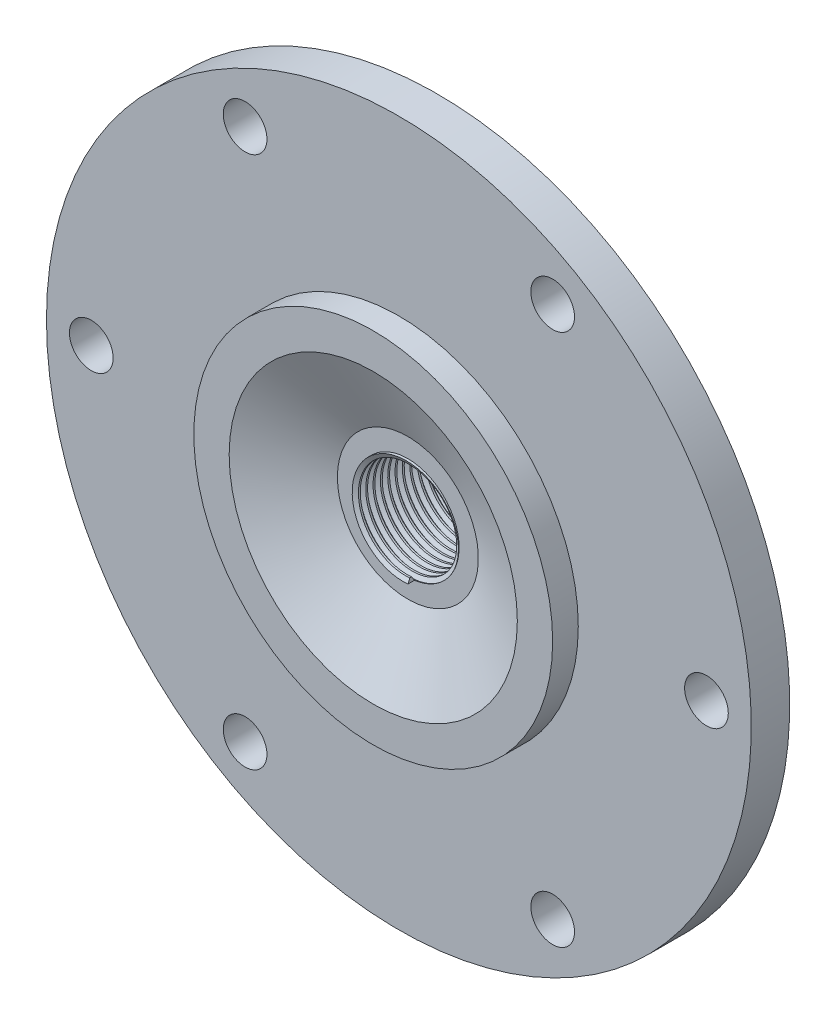
from build123d import *
from build123d.topology import SkipClean

# Parameters (mm, degrees)
SKETCH1_R                  = 43.65625
BOSS_EXTRUDE1_DEPTH        = 4.7625
SKETCH2_R                  = 22.225
BOSS_EXTRUDE2_DEPTH        = 3.175
SKETCH3_R                  = 9.525
BOSS_EXTRUDE3_DEPTH        = 14.2875
CHAMFER1_SIZE              = 6.35
CHAMFER1_SIZE2             = 3.666174209
F_3_0_213_DIAMETER_HOLE1_D = 5.4102
CUT_EXTRUDE1_REACH         = 67.618
SKETCH5_R                  = 6.35
THREAD1_PITCH              = 0.907142857


with BuildPart() as part:
    # Sketch1 → Boss-Extrude1 (new body)
    with BuildSketch(Plane.XY):
        with Locations(Location((0, 0, 0), (0, 0, 180))):
            Circle(SKETCH1_R)
    extrude(amount=BOSS_EXTRUDE1_DEPTH)

    # Sketch2 → Boss-Extrude2 (add)
    with BuildSketch(Plane.XY.offset(4.7625)):
        Circle(SKETCH2_R)
    extrude(amount=BOSS_EXTRUDE2_DEPTH)

    # Sketch3 → Boss-Extrude3 (add)
    with BuildSketch(Plane(origin=(0, 0, 0), x_dir=(-1, 0, 0), z_dir=(0, 0, -1))):
        Circle(SKETCH3_R)
    extrude(amount=BOSS_EXTRUDE3_DEPTH)

    # Chamfer1
    chamfer1_edges = [part.edges().sort_by_distance(p)[0] for p in [
        (9.525, 0, 0),
    ]]
    chamfer1_side = [part.faces().sort_by_distance(p)[0] for p in [
        (42.421464783, 0, 0),
    ]]
    chamfer(chamfer1_edges, length=CHAMFER1_SIZE, length2=CHAMFER1_SIZE2, reference=chamfer1_side[0])

    # Sketch4 → Cut-Revolve1 (revolve, cut)
    with BuildSketch(Plane(origin=(0, 0, 0), x_dir=(1, 0, 0), z_dir=(0, 1, 0)), mode=Mode.PRIVATE) as cut_revolve1_sk:
        Polygon((0, -3.647086845), (-8.73125, -3.647086845), (-17.848377953, -7.9375), (0, -7.9375), align=None)
    revolve(cut_revolve1_sk.sketch.rotate(Axis((0, 0, 3.647086845), (0, 0, 1)), 180), axis=Axis((0, 0, 3.647086845), (0, 0, 1)), mode=Mode.SUBTRACT)

    # #3 (0.213) Diameter Hole1 (through all)
    with Locations(Plane(origin=(-19.05, 32.995567884, 0), x_dir=(-1, 0, 0), z_dir=(0, 0, -1))):
        with Locations((0, 0), (-57.15, -32.995567884), (19.05, -32.995567884), (-38.1, 0), (-38.1, -65.991135768), (0, -65.991135768)):
            Hole(F_3_0_213_DIAMETER_HOLE1_D / 2)

    # Sketch5 → Cut-Extrude1 (cut, up to next)
    with BuildSketch(Plane(origin=(0, 0, -14.2875), x_dir=(-1, 0, 0), z_dir=(0, 0, -1)), mode=Mode.PRIVATE) as cut_extrude1_sk1:
        Circle(SKETCH5_R)
    cut_extrude1_tool1 = extrude(cut_extrude1_sk1.sketch, amount=-CUT_EXTRUDE1_REACH, mode=Mode.PRIVATE) & part.part
    add(cut_extrude1_tool1.solids().sort_by_distance((0, 0, -14.2875))[0], mode=Mode.SUBTRACT)

    # Thread1: the profile of Thread Profile1 profile screwed along a right-hand helix of 19.770411 turns, 8 arcs to a turn; built about Z, then put on its axis
    with SkipClean():  # the faces are left unmerged after this step: merging them gives an invalid solid
        thread1_z = Axis((0, 0, 0), (0, 0, 1))
        thread1_corners = [(6.3503, 0, -0.000173205), (6.3503, 0, 0.793923203), (5.858994528, 0, 0.510267856), (5.858994528, 0, 0.283482142)]
        with BuildLine(mode=Mode.PRIVATE) as thread1_profile:
            Line(thread1_corners[0], thread1_corners[1])
            Line(thread1_corners[1], thread1_corners[2])
            Line(thread1_corners[2], thread1_corners[3])
            Line(thread1_corners[3], thread1_corners[0])
        thread1_cap = Face(thread1_profile.wire())
        thread1_turn_angles = [0, 22.5, 45, 67.5, 90, 112.5, 135, 157.5, 180, 202.5, 225, 247.5, 270, 292.5, 315, 337.5, 360]
        thread1_turn_weights = [1, 0.9238795325112867, 1, 0.9238795325112867, 1, 0.9238795325112867, 1, 0.9238795325112867, 1, 0.9238795325112867, 1, 0.9238795325112867, 1, 0.9238795325112867, 1, 0.9238795325112867, 1]
        thread1_turn_rails = [Edge.make_bspline([Vector(p[0], p[1], 0).rotate(thread1_z, thread1_turn_angles[k]) / thread1_turn_weights[k] + Vector(0, 0, p[2] + THREAD1_PITCH * thread1_turn_angles[k] / 360) for k in range(17)], [0, 0, 0, 1, 1, 2, 2, 3, 3, 4, 4, 5, 5, 6, 6, 7, 7, 8, 8, 8], 2, thread1_turn_weights) for p in thread1_corners]
        thread1_turn_sides = [Face.make_surface_from_curves(thread1_turn_rails[p[0]], thread1_turn_rails[p[1]]) for p in [(0, 1), (1, 2), (2, 3), (3, 0)]]
        thread1_last_angles = [6840, 6862.5, 6885, 6907.5, 6930, 6952.5, 6975, 6997.5, 7020, 7042.5, 7065, 7087.5, 7110, 7113.673925243, 7117.347850485]
        thread1_last_weights = [1, 0.9238795325112867, 1, 0.9238795325112867, 1, 0.9238795325112867, 1, 0.9238795325112867, 1, 0.9238795325112867, 1, 0.9238795325112867, 1, 0.9979448829651867, 1]
        thread1_last_rails = [Edge.make_bspline([Vector(p[0], p[1], 0).rotate(thread1_z, thread1_last_angles[k]) / thread1_last_weights[k] + Vector(0, 0, p[2] + THREAD1_PITCH * thread1_last_angles[k] / 360) for k in range(15)], [0, 0, 0, 1, 1, 2, 2, 3, 3, 4, 4, 5, 5, 6, 6, 7, 7, 7], 2, thread1_last_weights) for p in thread1_corners]
        thread1_last_sides = [Face.make_surface_from_curves(thread1_last_rails[p[0]], thread1_last_rails[p[1]]) for p in [(0, 1), (1, 2), (2, 3), (3, 0)]]
        thread1 = Plane(origin=(0, 0, -14.2875), x_dir=(1, 0, 0), z_dir=(0, 0, 1)) * Solid(Shell([*[p.moved(Location((0, 0, THREAD1_PITCH * i))) for i in range(19) for p in thread1_turn_sides], *thread1_last_sides, thread1_cap, thread1_cap.rotate(thread1_z, 7117.347850485).moved(Location((0, 0, THREAD1_PITCH * 7117.347850485 / 360)))]))
        add(thread1)


solid = part.part
